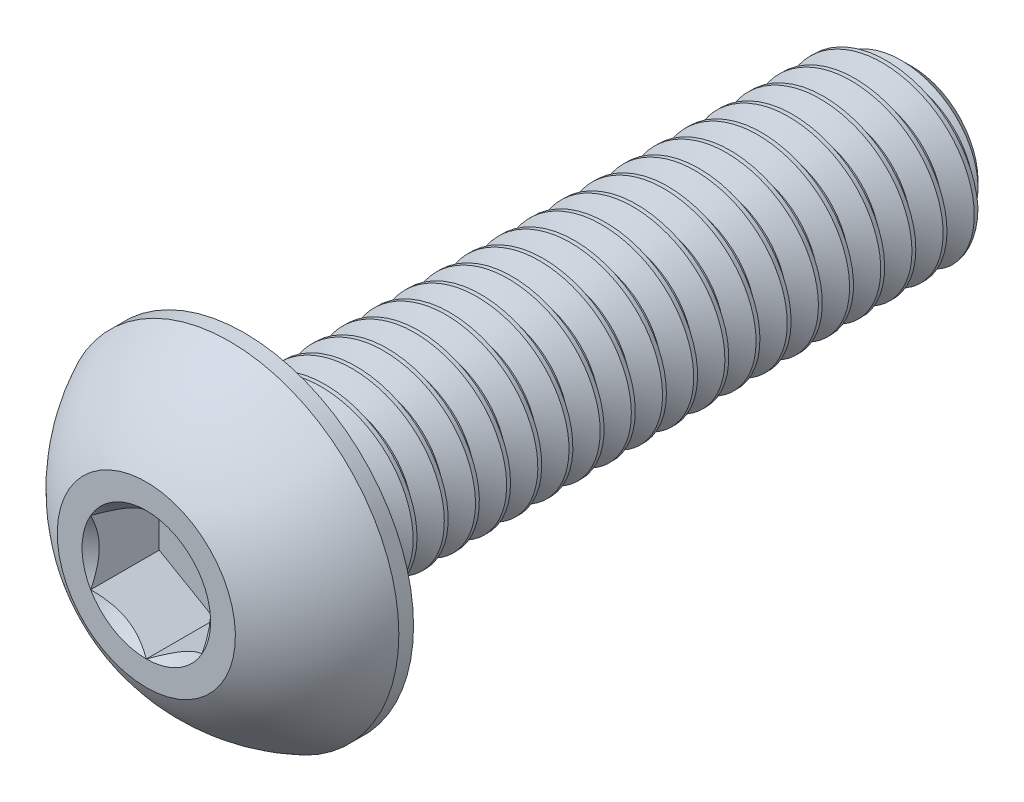
from build123d import *

# Parameters (mm, degrees)
CUT_EXTRUDE2_DEPTH = 1.54
CUT_SWEEP2_PITCH   = 0.7
CUT_SWEEP2_TO      = 15


with BuildPart() as part:
    # Sketch10 → Revolve3 (revolve)
    with BuildSketch(Plane(origin=(0, 0, 0), x_dir=(0, 0, -1), z_dir=(1, 0, 0)), mode=Mode.PRIVATE) as revolve3_sk:
        Polygon((16.675, 2), (17.2, 1.475), (17.2, 0), (2.2, 0), (2.2, 2), align=None)
    revolve(revolve3_sk.sketch.rotate(Axis((0, 0, 0), (0, 0, -1)), 90), axis=Axis((0, 0, 0), (0, 0, -1)))

    # Sketch7 → Revolve2 (revolve)
    with BuildSketch(Plane(origin=(0, 0, 0), x_dir=(0, 0, -1), z_dir=(1, 0, 0)), mode=Mode.PRIVATE) as revolve2_sk:
        with BuildLine():
            Line((1.87, 3.8), (2.2, 3.8))
            Line((2.2, 3.8), (2.2, 0))
            Line((2.2, 0), (0, 0))
            Line((0, 0), (0, 2))
            ThreePointArc((0, 2), (0.793500147, 3.047002626), (1.87, 3.8))
        make_face()
    revolve(revolve2_sk.sketch.rotate(Axis((0, 0, 0), (0, 0, -1)), 180), axis=Axis((0, 0, 0), (0, 0, -1)))

    # Sketch5 → Cut-Extrude2 (cut)
    with BuildSketch(Plane.XY):
        Polygon((1.25, -0.721687836), (1.25, 0.721687836), (0, 1.443375673), (-1.25, 0.721687836), (-1.25, -0.721687836), (0, -1.443375673), align=None)
    extrude(amount=-CUT_EXTRUDE2_DEPTH, mode=Mode.SUBTRACT)

    # Cut-Extrude3 cone 1 section (through the dimple's axis) → Cut-Extrude3 (revolve, cut)
    with BuildSketch(Plane(origin=(0, 0, 0), x_dir=(0, -1, 0), z_dir=(1, 0, 0))):
        Polygon((0, 0), (1.443375673, 0), (0, 1.443375673), align=None)
    revolve(axis=Axis((0, 0, 0), (0, 0, -1)), mode=Mode.SUBTRACT)


with BuildPart() as body_2:
    # Split1: read off the stored shape, not the designer's step
    # Split1: the piece on the far side of the plane
    add(part.part)
    split(bisect_by=Plane.XY.offset(-2.2), keep=Keep.BOTTOM)

    # Cut-Sweep2: arcs per turn and ends read off the stored shape
    # Cut-Sweep2: the profile of Sketch12 screwed along a right-hand helix through 25.666667 turns, 6 arcs to a turn; built about Z, then put on its axis
    cut_sweep2_z = Axis((0, 0, 0), (0, 0, 1))
    cut_sweep2_corners = [(1.545336663, 0, -0.2625), (1.545336663, 0, -0.35), (2.037888611, 0, -0.634375), (2.037888611, 0, 0.021875)]
    with BuildLine(mode=Mode.PRIVATE) as cut_sweep2_profile:
        Line(cut_sweep2_corners[0], cut_sweep2_corners[1])
        Line(cut_sweep2_corners[1], cut_sweep2_corners[2])
        Line(cut_sweep2_corners[2], cut_sweep2_corners[3])
        Line(cut_sweep2_corners[3], cut_sweep2_corners[0])
    cut_sweep2_cap = Face(cut_sweep2_profile.wire())
    cut_sweep2_turn_angles = [0, 30, 60, 90, 120, 150, 180, 210, 240, 270, 300, 330, 360]
    cut_sweep2_turn_weights = [1, 0.8660254037844387, 1, 0.8660254037844387, 1, 0.8660254037844387, 1, 0.8660254037844387, 1, 0.8660254037844387, 1, 0.8660254037844387, 1]
    cut_sweep2_turn_rails = [Edge.make_bspline([Vector(p[0], p[1], 0).rotate(cut_sweep2_z, cut_sweep2_turn_angles[k]) / cut_sweep2_turn_weights[k] + Vector(0, 0, p[2] + CUT_SWEEP2_PITCH * cut_sweep2_turn_angles[k] / 360) for k in range(13)], [0, 0, 0, 1, 1, 2, 2, 3, 3, 4, 4, 5, 5, 6, 6, 6], 2, cut_sweep2_turn_weights) for p in cut_sweep2_corners]
    cut_sweep2_turn_sides = [Face.make_surface_from_curves(cut_sweep2_turn_rails[p[0]], cut_sweep2_turn_rails[p[1]]) for p in [(0, 1), (1, 2), (2, 3), (3, 0)]]
    cut_sweep2_last_angles = [9000, 9030, 9060, 9090, 9120, 9150, 9180, 9210, 9240]
    cut_sweep2_last_weights = [1, 0.8660254037844387, 1, 0.8660254037844387, 1, 0.8660254037844387, 1, 0.8660254037844387, 1]
    cut_sweep2_last_rails = [Edge.make_bspline([Vector(p[0], p[1], 0).rotate(cut_sweep2_z, cut_sweep2_last_angles[k]) / cut_sweep2_last_weights[k] + Vector(0, 0, p[2] + CUT_SWEEP2_PITCH * cut_sweep2_last_angles[k] / 360) for k in range(9)], [0, 0, 0, 1, 1, 2, 2, 3, 3, 4, 4, 4], 2, cut_sweep2_last_weights) for p in cut_sweep2_corners]
    cut_sweep2_last_sides = [Face.make_surface_from_curves(cut_sweep2_last_rails[p[0]], cut_sweep2_last_rails[p[1]]) for p in [(0, 1), (1, 2), (2, 3), (3, 0)]]
    cut_sweep2 = Plane(origin=(0, 0, -17.2), x_dir=(0, 1, 0), z_dir=(0, 0, 1)) * split(Solid(Shell([*[p.moved(Location((0, 0, CUT_SWEEP2_PITCH * i))) for i in range(25) for p in cut_sweep2_turn_sides], *cut_sweep2_last_sides, cut_sweep2_cap, cut_sweep2_cap.rotate(cut_sweep2_z, 9240).moved(Location((0, 0, CUT_SWEEP2_PITCH * 9240 / 360)))])), bisect_by=Plane.XY.offset(CUT_SWEEP2_TO), keep=Keep.BOTTOM, mode=Mode.PRIVATE)
    add(cut_sweep2, mode=Mode.SUBTRACT)


with BuildPart() as part_1:
    add(part.part)

    # Split1
    split(bisect_by=Plane.XY.offset(-2.2), keep=Keep.TOP)

    add(body_2.part)  # Boss-Extrude1 merges body 2
    # Boss-Extrude1: read off the stored shape, not the designer's step
    # Boss-Extrude1 outline → Boss-Extrude1 (revolve)
    with BuildSketch(Plane.XZ):
        Polygon((1.545332213, -2.2), (1.545332213, -2.654667787), (2, -2.2), align=None)
    revolve(axis=Axis((0, 0, 0), (0, 0, 1)))


solid = part_1.part
